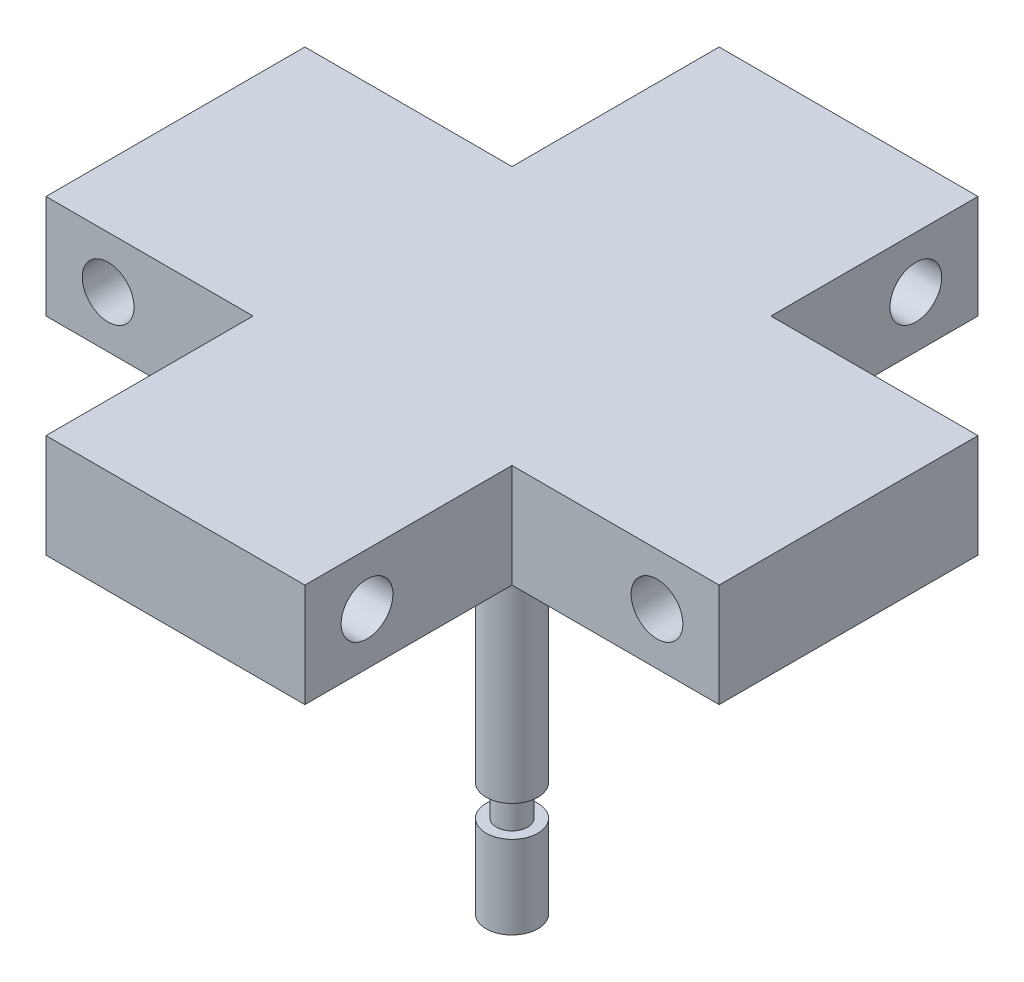
from build123d import *

# Parameters (mm, degrees)
BOSS_EXTRUDE1_DEPTH = 10
SKETCH2_R           = 2.5
CUT_EXTRUDE1_DEPTH  = 57.402570863
SKETCH3_R           = 2.5
CUT_EXTRUDE2_DEPTH  = 57.402570863
SKETCH4_R           = 2.5
BOSS_EXTRUDE2_DEPTH = 40
SKETCH5_W           = 1
SKETCH5_H           = 3


with BuildPart() as part:
    # Sketch1 → Boss-Extrude1 (new body)
    with BuildSketch(Plane(origin=(0, 0, 0), x_dir=(1, 0, 0), z_dir=(0, 1, 0))):
        Polygon((12.5, -32.5), (12.5, -12.5), (32.5, -12.5), (32.5, 12.5), (12.5, 12.5), (12.5, 32.5), (-12.5, 32.5), (-12.5, 12.5), (-32.5, 12.5), (-32.5, -12.5), (-12.5, -12.5), (-12.5, -32.5), align=None)
    extrude(amount=BOSS_EXTRUDE1_DEPTH)

    # Sketch2 → Cut-Extrude1 (cut, through all)
    with BuildSketch(Plane(origin=(12.5, 0, 0), x_dir=(0, 0, -1), z_dir=(1, 0, 0))):
        with Locations((-26.499999999, 5)):
            Circle(SKETCH2_R)
        with Locations((26.499999999, 5)):
            Circle(SKETCH2_R)
    extrude(amount=-CUT_EXTRUDE1_DEPTH, mode=Mode.SUBTRACT)

    # Sketch3 → Cut-Extrude2 (cut, through all)
    with BuildSketch(Plane.XY.offset(12.5)):
        with Locations((26.5, 5)):
            Circle(SKETCH3_R)
        with Locations((-26.5, 5)):
            Circle(SKETCH3_R)
    extrude(amount=-CUT_EXTRUDE2_DEPTH, mode=Mode.SUBTRACT)

    # Sketch4 → Boss-Extrude2 (add)
    with BuildSketch(Plane(origin=(0, 0, 0), x_dir=(1, 0, 0), z_dir=(0, 1, 0))):
        Circle(SKETCH4_R)
    extrude(amount=-BOSS_EXTRUDE2_DEPTH)

    # Sketch5 → Cut-Revolve1 (revolve, cut)
    with BuildSketch(Plane(origin=(0, 0, 0), x_dir=(0, 0, -1), z_dir=(1, 0, 0))):
        with Locations((2, -30.5)):
            Rectangle(SKETCH5_W, SKETCH5_H)
    revolve(axis=Axis((0, 0, 0), (0, -1, 0)), mode=Mode.SUBTRACT)


solid = part.part
